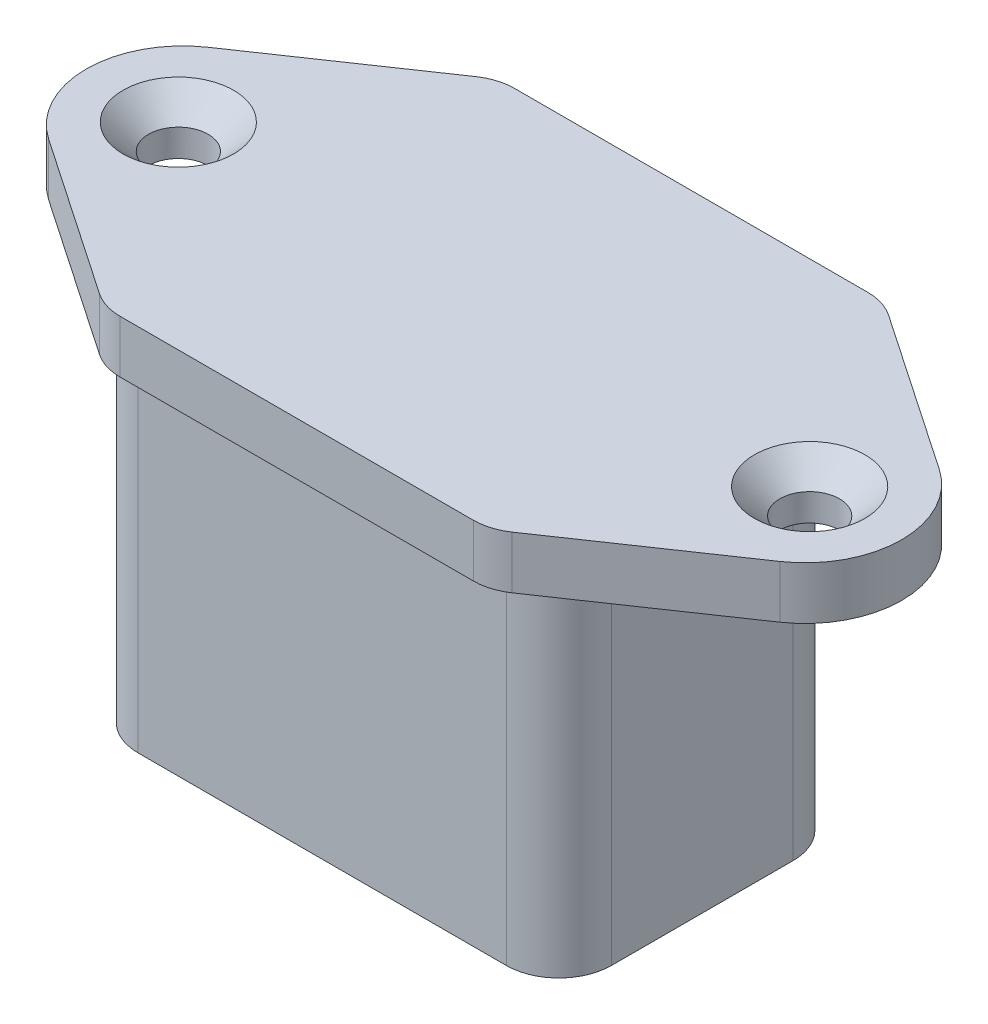
from build123d import *

# Parameters (mm, degrees)
SKIZZE1_W                                    = 27
SKIZZE1_H                                    = 19.5
AUFSATZ_LINEAR_AUSTRAGEN1_DEPTH              = 19.6
FASE1_SIZE                                   = 5
AUFSATZ_LINEAR_AUSTRAGEN2_DEPTH              = 3
VERRUNDUNG1_R                                = 3
FORMSENKUNG_F_R_M3_LINSENSENKSCHRAUB_2_COUNT = 2
FORMSENKUNG_F_R_M3_LINSENSENKSCHRAUB_2_PITCH = 36


with BuildPart() as part:
    # Skizze1 → Aufsatz-Linear austragen1 (new body)
    with BuildSketch(Plane.XY):
        Rectangle(SKIZZE1_W, SKIZZE1_H)
    extrude(amount=AUFSATZ_LINEAR_AUSTRAGEN1_DEPTH)

    # Fase1
    fase1_edges = [part.edges().sort_by_distance(p)[0] for p in [
        (-13.5, 0, 0),
        (13.5, 0, 0),
    ]]
    chamfer(fase1_edges, length=FASE1_SIZE)

    # Skizze2 → Aufsatz-Linear austragen2 (add)
    with BuildSketch(Plane(origin=(0, 9.75, 0), x_dir=(1, 0, 0), z_dir=(0, 1, 0))):
        with BuildLine():
            Line((-11, 1.45), (11, 1.45))
            Line((11, 1.45), (20.845503979, -5.253808724))
            ThreePointArc((20.845503979, -5.253808724), (23.25, -9.8), (20.845503979, -14.346191276))
            Line((20.845503979, -14.346191276), (11, -21.05))
            Line((11, -21.05), (-11, -21.05))
            Line((-11, -21.05), (-20.845503979, -14.346191276))
            ThreePointArc((-20.845503979, -14.346191276), (-23.25, -9.8), (-20.845503979, -5.253808724))
            Line((-20.845503979, -5.253808724), (-11, 1.45))
        make_face()
    extrude(amount=AUFSATZ_LINEAR_AUSTRAGEN2_DEPTH)

    # Verrundung1
    # the kernel refuses this fillet: 3 mm, written as the material it takes off along each edge
    with BuildSketch(Plane(origin=(-13.5, 9.75, 19.6), x_dir=(0, 0, -1), z_dir=(0, -1, 0))) as verrundung1_piece_1:
        with BuildLine():
            CenterArc((VERRUNDUNG1_R, VERRUNDUNG1_R), VERRUNDUNG1_R, 180, 90)
            Line((0, VERRUNDUNG1_R), (0, 0))
            Line((0, 0), (VERRUNDUNG1_R, 0))
        make_face()
    extrude(amount=27, mode=Mode.SUBTRACT)
    with BuildSketch(Plane(origin=(13.5, -12.856601718, 5), x_dir=(0, 0, 1), z_dir=(0, 1, 0)), Plane(origin=(-8.5, 9.75, 0), x_dir=(-0.7071067811865469, 0, 0.707106781186548), z_dir=(0, -1, 0)), Plane(origin=(-13.5, 9.75, 5), x_dir=(0, 0, 1), z_dir=(0, -1, 0))) as verrundung1_piece_2:
        with BuildLine():
            CenterArc((VERRUNDUNG1_R * 0.414213562373, -VERRUNDUNG1_R), VERRUNDUNG1_R, 90, 45)
            Line((-VERRUNDUNG1_R * 0.292893218813, -VERRUNDUNG1_R * 0.292893218813), (0, 0))
            Line((0, 0), (VERRUNDUNG1_R * 0.414213562373, 0))
        make_face()
    extrude(amount=22.606601718, mode=Mode.SUBTRACT)
    with BuildSketch(Plane(origin=(8.5, -12.856601718, 0), x_dir=(-1, 0, 0), z_dir=(0, 1, 0))) as verrundung1_piece_3:
        with BuildLine():
            CenterArc((VERRUNDUNG1_R * 0.414213562373, VERRUNDUNG1_R), VERRUNDUNG1_R, 225, 45)
            Line((-VERRUNDUNG1_R * 0.292893218813, VERRUNDUNG1_R * 0.292893218813), (0, 0))
            Line((0, 0), (VERRUNDUNG1_R * 0.414213562373, 0))
        make_face()
    extrude(amount=22.606601718, mode=Mode.SUBTRACT)
    with BuildSketch(Plane(origin=(11, 7.439046605, -1.45), x_dir=(0.8265802320093436, 0, 0.5628189052007578), z_dir=(0, 1, 0)), Plane(origin=(-11, 7.439046605, -1.45), x_dir=(1, 0, 0), z_dir=(0, 1, 0)), Plane(origin=(-11, 7.439046605, 21.05), x_dir=(-0.8265802320093435, 0, -0.5628189052007582), z_dir=(0, 1, 0))) as verrundung1_piece_4:
        with BuildLine():
            CenterArc((VERRUNDUNG1_R * 0.308127119377, -VERRUNDUNG1_R), VERRUNDUNG1_R, 90, 34.250968868)
            Line((-VERRUNDUNG1_R * 0.254691785823, -VERRUNDUNG1_R * 0.173419767991), (0, 0))
            Line((0, 0), (VERRUNDUNG1_R * 0.308127119377, 0))
        make_face()
    extrude(amount=7.621906791, mode=Mode.SUBTRACT)
    with BuildSketch(Plane(origin=(11, 7.439046605, 21.05), x_dir=(0.8265802320093447, 0, -0.5628189052007564), z_dir=(0, 1, 0))) as verrundung1_piece_5:
        with BuildLine():
            CenterArc((VERRUNDUNG1_R * 0.308127119377, VERRUNDUNG1_R), VERRUNDUNG1_R, 235.749031132, 34.250968868)
            Line((-VERRUNDUNG1_R * 0.254691785823, VERRUNDUNG1_R * 0.173419767991), (0, 0))
            Line((0, 0), (VERRUNDUNG1_R * 0.308127119377, 0))
        make_face()
    extrude(amount=7.621906791, mode=Mode.SUBTRACT)
    with BuildSketch(Plane(origin=(13.5, -17.25, 19.6), x_dir=(-1, 0, 0), z_dir=(0, 1, 0))) as verrundung1_piece_6:
        with BuildLine():
            CenterArc((VERRUNDUNG1_R, -VERRUNDUNG1_R), VERRUNDUNG1_R, 90, 90)
            Line((0, -VERRUNDUNG1_R), (0, 0))
            Line((0, 0), (VERRUNDUNG1_R, 0))
        make_face()
    extrude(amount=27, mode=Mode.SUBTRACT)

    # Skizze4 → Formsenkung für M3 Linsensenkschraube mit Schlitz1 (revolve, cut)
    with BuildSketch(Plane(origin=(-18, 12.75, 9.8), x_dir=(0, 0, 1), z_dir=(1, 0, 0))):
        Polygon((0, 0), (0, 3), (1.7, 3), (1.7, 1.45), (3.15, 0), align=None)
    formsenkung_f_r_m3_linsensenkschraube_mi = revolve(axis=Axis((-18, 19.1, 9.8), (0, -1, 0)), mode=Mode.SUBTRACT)

    # Formsenkung f_r M3 Linsensenkschraub 2: Formsenkung für M3 Linsensenkschraube mit Schlitz1 ×2
    with Locations(*[(i * FORMSENKUNG_F_R_M3_LINSENSENKSCHRAUB_2_PITCH, 0, 0) for i in range(1, FORMSENKUNG_F_R_M3_LINSENSENKSCHRAUB_2_COUNT)]):
        add(formsenkung_f_r_m3_linsensenkschraube_mi, mode=Mode.SUBTRACT)


solid = part.part
